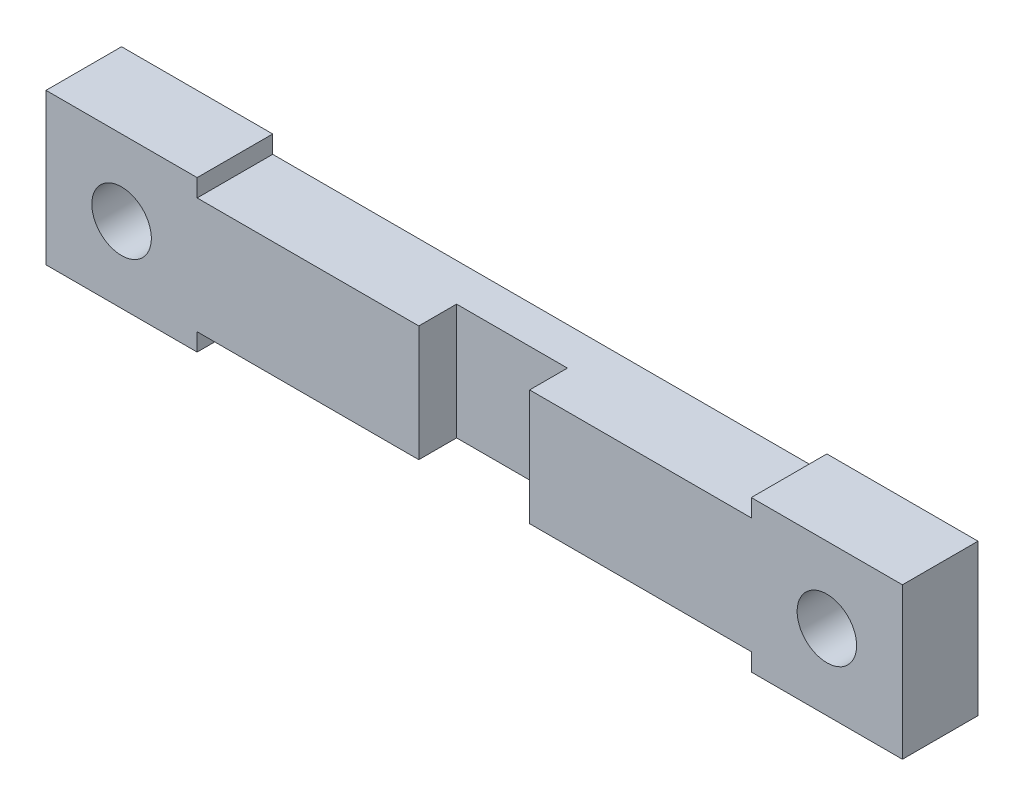
from build123d import *

# Parameters (mm, degrees)
SKETCH1_R           = 1.5
BOSS_EXTRUDE1_DEPTH = 3.81
SKETCH2_W           = 5.588
SKETCH2_H           = 5.842
CUT_EXTRUDE1_DEPTH  = 1.905


with BuildPart() as part:
    # Sketch1 → Boss-Extrude1 (new body)
    with BuildSketch(Plane.XY):
        Polygon((13.97, 2.921), (-13.97, 2.921), (-13.97, 3.81), (-21.59, 3.81), (-21.59, -3.81), (-13.97, -3.81), (-13.97, -2.921), (13.97, -2.921), (13.97, -3.81), (21.59, -3.81), (21.59, 3.81), (13.97, 3.81), align=None)
        with Locations((-17.78, 0)):
            Circle(SKETCH1_R, mode=Mode.SUBTRACT)
        with Locations((17.78, 0)):
            Circle(SKETCH1_R, mode=Mode.SUBTRACT)
    extrude(amount=BOSS_EXTRUDE1_DEPTH)

    # Sketch2 → Cut-Extrude1 (cut)
    with BuildSketch(Plane.XY.offset(3.81)):
        Rectangle(SKETCH2_W, SKETCH2_H)
    extrude(amount=-CUT_EXTRUDE1_DEPTH, mode=Mode.SUBTRACT)


solid = part.part
